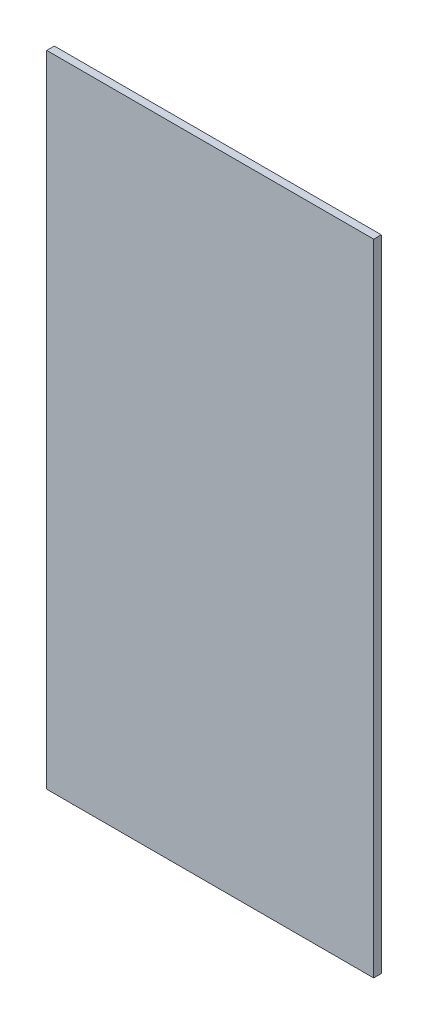
from build123d import *

# Parameters (mm, degrees)
SKETCH1_W           = 258.57
SKETCH1_H           = 506
BOSS_EXTRUDE1_DEPTH = 6


with BuildPart() as part:
    # Sketch1 → Boss-Extrude1 (new body)
    with BuildSketch(Plane.XY):
        with Locations((129.285, 253)):
            Rectangle(SKETCH1_W, SKETCH1_H)
    extrude(amount=BOSS_EXTRUDE1_DEPTH)


solid = part.part
